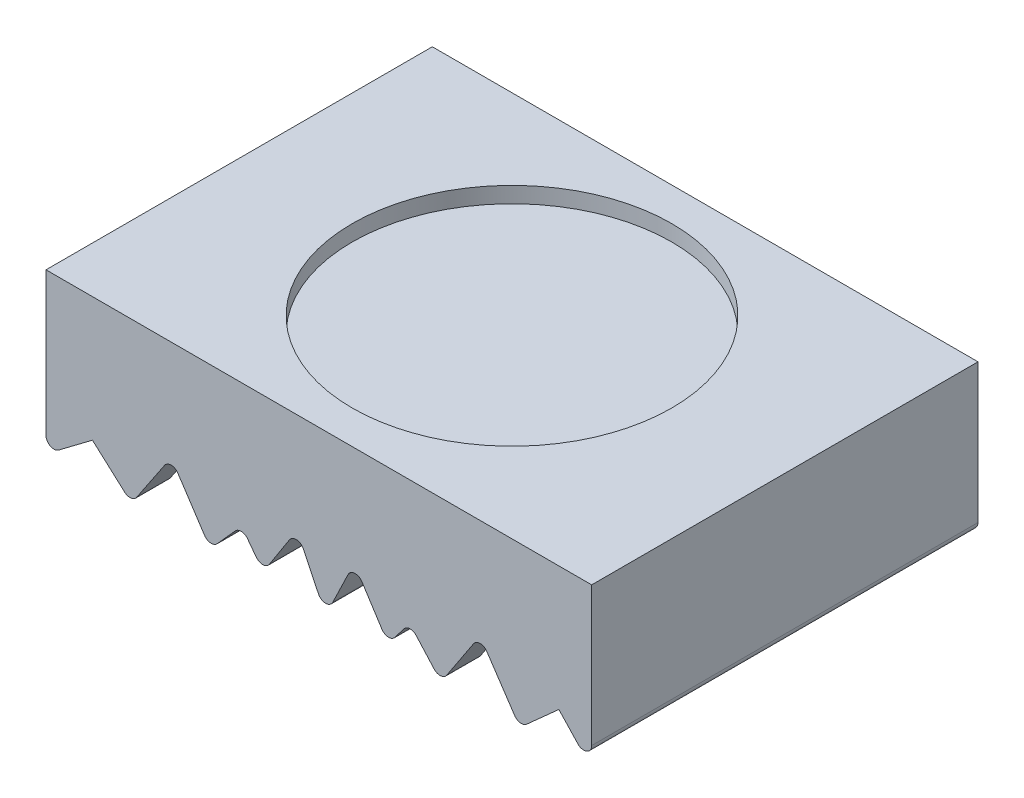
from build123d import *

# Parameters (mm, degrees)
SKETCH1_W           = 34.242640688
SKETCH1_H           = 24.242640688
SKETCH1_W_2         = 30
SKETCH1_H_2         = 20
BOSS_EXTRUDE1_DEPTH = 8
SKETCH2_W           = 34.242640688
SKETCH2_H           = 24.242640688
BOSS_EXTRUDE2_DEPTH = 2
SKETCH3_R           = 10.025
CUT_EXTRUDE1_DEPTH  = 1
CUT_EXTRUDE2_DEPTH  = 41
FILLET4_R           = 0.5


with BuildPart() as part:
    # Sketch1 → Boss-Extrude1 (new body)
    with BuildSketch(Plane(origin=(0, 0, 0), x_dir=(1, 0, 0), z_dir=(0, 1, 0))):
        with Locations((0, 10)):
            Rectangle(SKETCH1_W, SKETCH1_H)
        with Locations((0, 10)):
            Rectangle(SKETCH1_W_2, SKETCH1_H_2, mode=Mode.SUBTRACT)
    extrude(amount=BOSS_EXTRUDE1_DEPTH)

    # Sketch2 → Boss-Extrude2 (add)
    with BuildSketch(Plane(origin=(0, 8, 0), x_dir=(1, 0, 0), z_dir=(0, 1, 0))):
        with Locations((0, 10)):
            Rectangle(SKETCH2_W, SKETCH2_H)
    extrude(amount=BOSS_EXTRUDE2_DEPTH)

    # Sketch3 → Cut-Extrude1 (cut)
    with BuildSketch(Plane(origin=(0, 10, 0), x_dir=(1, 0, 0), z_dir=(0, 1, 0))):
        with Locations((0, 10)):
            Circle(SKETCH3_R)
    extrude(amount=-CUT_EXTRUDE1_DEPTH, mode=Mode.SUBTRACT)

    # Sketch5 → Cut-Extrude2 (cut)
    with BuildSketch(Plane.XY.offset(2.121320344)):
        Polygon((15.063409899, 2.197505135), (12.611226892, 0), (17.121320344, 0), align=None)
        Polygon((10.120120345, 3.715523187), (7.667937339, 0), (12.611226892, 0), align=None)
        Polygon((2.218641768, 3.715523187), (0.428158938, 0), (7.667937339, 0), (5.698659839, 2.197505135), (4.346377616, 0.404171828), align=None)
        Polygon((-4.842341964, 2.197505135), (-6.811619463, 0), (0.428158938, 0), (-1.362323893, 3.715523187), (-3.490059741, 0.404171828), align=None)
        Polygon((-9.26380247, 3.715523187), (-11.754909017, 0), (-6.811619463, 0), align=None)
        Polygon((-14.207092023, 2.197505135), (-17.121320344, 0), (-11.754909017, 0), align=None)
    extrude(amount=-CUT_EXTRUDE2_DEPTH, mode=Mode.SUBTRACT)

    # Fillet4
    fillet4_edges = [part.edges().sort_by_distance(p)[0] for p in [
        (12.611226892, 0, -21.060660172),
        (10.120120345, 3.715523187, -21.060660172),
        (7.667937339, 0, -21.060660172),
        (5.698659839, 2.197505135, -21.060660172),
        (4.346377616, 0.404171828, -21.060660172),
        (2.218641768, 3.715523187, -21.060660172),
        (0.428158938, 0, -21.060660172),
        (-1.362323893, 3.715523187, -21.060660172),
        (-3.490059741, 0.404171828, -21.060660172),
        (-4.842341964, 2.197505135, -21.060660172),
        (-6.811619463, 0, -21.060660172),
        (-9.26380247, 3.715523187, -21.060660172),
        (-11.754909017, 0, -21.060660172),
        (-14.207092023, 2.197505135, -21.060660172),
        (-9.26380247, 3.715523187, 1.060660172),
        (-4.842341964, 2.197505135, 1.060660172),
        (-1.362323893, 3.715523187, 1.060660172),
        (2.218641768, 3.715523187, 1.060660172),
        (5.698659839, 2.197505135, 1.060660172),
        (10.120120345, 3.715523187, 1.060660172),
        (12.611226892, 0, 1.060660172),
        (7.667937339, 0, 1.060660172),
        (4.346377616, 0.404171828, 1.060660172),
        (0.428158938, 0, 1.060660172),
        (-3.490059741, 0.404171828, 1.060660172),
        (-6.811619463, 0, 1.060660172),
        (-11.754909017, 0, 1.060660172),
        (17.121320344, 0, -10),
        (-17.121320344, 0, -10),
    ]]
    fillet(fillet4_edges, radius=FILLET4_R)


solid = part.part
